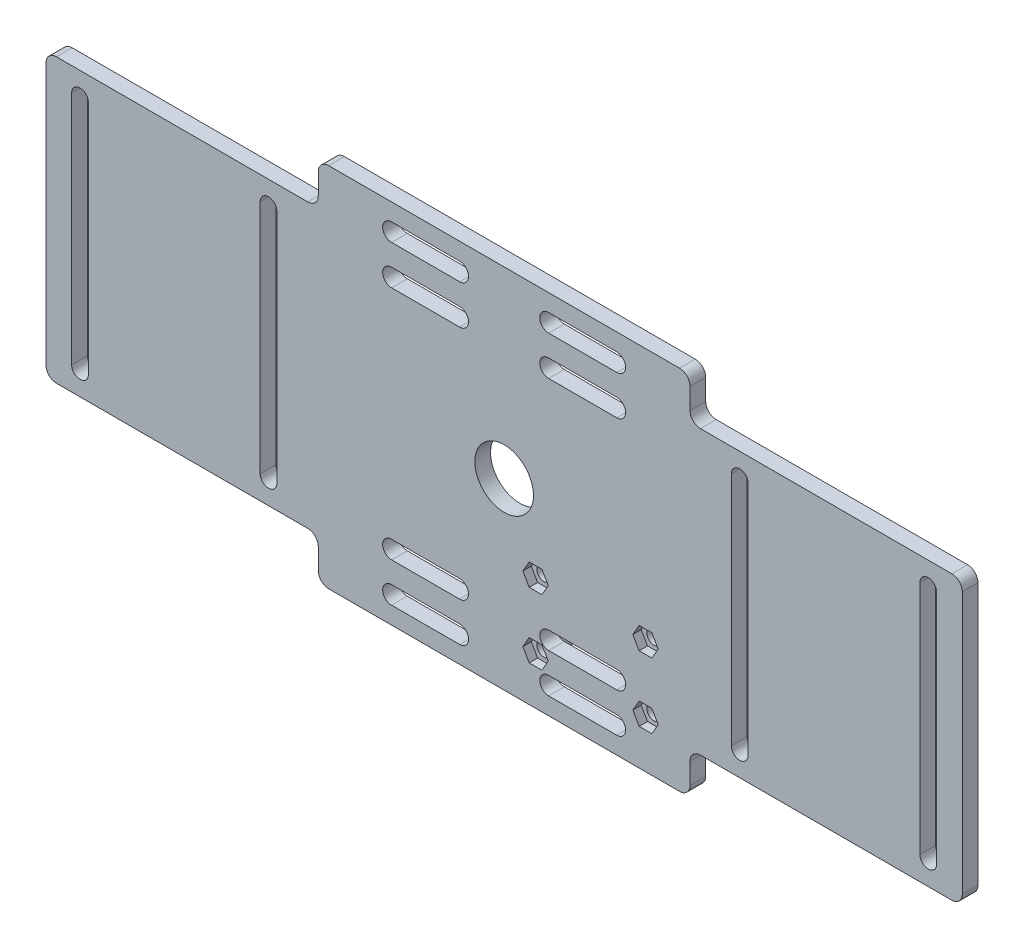
from build123d import *
from OCP.BRepFilletAPI import BRepFilletAPI_MakeChamfer
from build123d.topology import SkipClean

# Parameters (mm, degrees)
EXTRUDE_1_DEPTH     = 3
SKETCH_2_R          = 5.6
SKETCH_2_R_2        = 1.35
CUT_EXTRUDE_1_DEPTH = 95.288122264
CUT_EXTRUDE_2_DEPTH = 1.6
SKETCH_4_R          = 2.1
SKETCH_4_R_2        = 1.35
SKETCH_4_R_3        = 2
SKETCH_4_R_4        = 1.25
EXTRUDE_2_DEPTH     = 2
CHAMFER_1_SIZE      = 0.5
CHAMFER_1_SIZE2     = 0.288675135
FILLET_2_R          = 0.5


with BuildPart() as part:
    # 草圖1 → 填料-伸長1 (new body)
    with BuildSketch(Plane.XY):
        with BuildLine():
            Line((35.5, 33), (35.5, 29))
            ThreePointArc((35.5, 29), (36.085786438, 27.585786438), (37.5, 27))
            Line((37.5, 27), (85.5, 27))
            ThreePointArc((85.5, 27), (86.914213562, 26.414213562), (87.5, 25))
            Line((87.5, 25), (87.5, -25))
            ThreePointArc((87.5, -25), (86.914213562, -26.414213562), (85.5, -27))
            Line((85.5, -27), (37.5, -27))
            ThreePointArc((37.5, -27), (36.085786438, -27.585786438), (35.5, -29))
            Line((35.5, -29), (35.5, -33))
            ThreePointArc((35.5, -33), (34.914213562, -34.414213562), (33.5, -35))
            Line((33.5, -35), (-33.5, -35))
            ThreePointArc((-33.5, -35), (-34.914213562, -34.414213562), (-35.5, -33))
            Line((-35.5, -33), (-35.5, -29))
            ThreePointArc((-35.5, -29), (-36.085786438, -27.585786438), (-37.5, -27))
            Line((-37.5, -27), (-85.5, -27))
            ThreePointArc((-85.5, -27), (-86.914213562, -26.414213562), (-87.5, -25))
            Line((-87.5, -25), (-87.5, 25))
            ThreePointArc((-87.5, 25), (-86.914213562, 26.414213562), (-85.5, 27))
            Line((-85.5, 27), (-37.5, 27))
            ThreePointArc((-37.5, 27), (-36.085786438, 27.585786438), (-35.5, 29))
            Line((-35.5, 29), (-35.5, 33))
            ThreePointArc((-35.5, 33), (-34.914213562, 34.414213562), (-33.5, 35))
            Line((-33.5, 35), (33.5, 35))
            ThreePointArc((33.5, 35), (34.914213562, 34.414213562), (35.5, 33))
        make_face()
    extrude(amount=EXTRUDE_1_DEPTH)

    # 草圖2 → 除料-伸長1 (cut, through all)
    with BuildSketch(Plane.XY.offset(3)):
        Circle(SKETCH_2_R)
        with Locations((27, -13.5)):
            Circle(SKETCH_2_R_2)
        with Locations((6, -13.5)):
            Circle(SKETCH_2_R_2)
        with Locations((6, -26)):
            Circle(SKETCH_2_R_2)
        with Locations((27, -26)):
            Circle(SKETCH_2_R_2)
        with BuildLine():
            Line((43.4, -22.5), (43.4, 22.5))
            ThreePointArc((43.4, 22.5), (45, 24.1), (46.6, 22.5))
            Line((46.6, 22.5), (46.6, -22.5))
            ThreePointArc((46.6, -22.5), (45, -24.1), (43.4, -22.5))
        make_face()
        with BuildLine():
            Line((-46.6, -22.5), (-46.6, 22.5))
            ThreePointArc((-46.6, 22.5), (-45, 24.1), (-43.4, 22.5))
            Line((-43.4, 22.5), (-43.4, -22.5))
            ThreePointArc((-43.4, -22.5), (-45, -24.1), (-46.6, -22.5))
        make_face()
        with BuildLine():
            Line((-82.6, -22.5), (-82.6, 22.5))
            ThreePointArc((-82.6, 22.5), (-81, 24.1), (-79.4, 22.5))
            Line((-79.4, 22.5), (-79.4, -22.5))
            ThreePointArc((-79.4, -22.5), (-81, -24.1), (-82.6, -22.5))
        make_face()
        with BuildLine():
            Line((79.4, -22.5), (79.4, 22.5))
            ThreePointArc((79.4, 22.5), (81, 24.1), (82.6, 22.5))
            Line((82.6, 22.5), (82.6, -22.5))
            ThreePointArc((82.6, -22.5), (81, -24.1), (79.4, -22.5))
        make_face()
        with BuildLine():
            Line((21.5, -31.7), (8.5, -31.7))
            ThreePointArc((8.5, -31.7), (6.8, -30), (8.5, -28.3))
            Line((8.5, -28.3), (21.5, -28.3))
            ThreePointArc((21.5, -28.3), (23.2, -30), (21.5, -31.7))
        make_face()
        with BuildLine():
            Line((-21.5, -31.7), (-8.5, -31.7))
            ThreePointArc((-8.5, -31.7), (-6.8, -30), (-8.5, -28.3))
            Line((-8.5, -28.3), (-21.5, -28.3))
            ThreePointArc((-21.5, -28.3), (-23.2, -30), (-21.5, -31.7))
        make_face()
        with BuildLine():
            Line((21.5, 31.7), (8.5, 31.7))
            ThreePointArc((8.5, 31.7), (6.8, 30), (8.5, 28.3))
            Line((8.5, 28.3), (21.5, 28.3))
            ThreePointArc((21.5, 28.3), (23.2, 30), (21.5, 31.7))
        make_face()
        with BuildLine():
            Line((-21.5, 31.7), (-8.5, 31.7))
            ThreePointArc((-8.5, 31.7), (-6.8, 30), (-8.5, 28.3))
            Line((-8.5, 28.3), (-21.5, 28.3))
            ThreePointArc((-21.5, 28.3), (-23.2, 30), (-21.5, 31.7))
        make_face()
        with BuildLine():
            Line((21.5, 24.2), (8.5, 24.2))
            ThreePointArc((8.5, 24.2), (6.8, 22.5), (8.5, 20.8))
            Line((8.5, 20.8), (21.5, 20.8))
            ThreePointArc((21.5, 20.8), (23.2, 22.5), (21.5, 24.2))
        make_face()
        with BuildLine():
            Line((-21.5, 24.2), (-8.5, 24.2))
            ThreePointArc((-8.5, 24.2), (-6.8, 22.5), (-8.5, 20.8))
            Line((-8.5, 20.8), (-21.5, 20.8))
            ThreePointArc((-21.5, 20.8), (-23.2, 22.5), (-21.5, 24.2))
        make_face()
        with BuildLine():
            Line((-21.5, -24.2), (-8.5, -24.2))
            ThreePointArc((-8.5, -24.2), (-6.8, -22.5), (-8.5, -20.8))
            Line((-8.5, -20.8), (-21.5, -20.8))
            ThreePointArc((-21.5, -20.8), (-23.2, -22.5), (-21.5, -24.2))
        make_face()
        with BuildLine():
            Line((21.5, -24.2), (8.5, -24.2))
            ThreePointArc((8.5, -24.2), (6.8, -22.5), (8.5, -20.8))
            Line((8.5, -20.8), (21.5, -20.8))
            ThreePointArc((21.5, -20.8), (23.2, -22.5), (21.5, -24.2))
        make_face()
    extrude(amount=-CUT_EXTRUDE_1_DEPTH, mode=Mode.SUBTRACT)

    # 草圖3 → 除料-伸長2 (cut)
    with BuildSketch(Plane.XY.offset(3)):
        Polygon((29.424871131, -26), (28.212435565, -23.9), (25.787564435, -23.9), (24.575128869, -26), (25.787564435, -28.1), (28.212435565, -28.1), align=None)
        Polygon((8.424871131, -26), (7.212435565, -23.9), (4.787564435, -23.9), (3.575128869, -26), (4.787564435, -28.1), (7.212435565, -28.1), align=None)
        Polygon((29.424871131, -13.5), (28.212435565, -11.4), (25.787564435, -11.4), (24.575128869, -13.5), (25.787564435, -15.6), (28.212435565, -15.6), align=None)
        Polygon((8.424871131, -13.5), (7.212435565, -11.4), (4.787564435, -11.4), (3.575128869, -13.5), (4.787564435, -15.6), (7.212435565, -15.6), align=None)
    extrude(amount=-CUT_EXTRUDE_2_DEPTH, mode=Mode.SUBTRACT)

    # 草圖4 → 填料-伸長2 (add)
    # profile 1 of 4: a face of its own
    with SkipClean():  # the faces are left unmerged after this step: merging them gives an invalid solid
        with BuildSketch(Plane(origin=(0, 0, 0), x_dir=(-1, 0, 0), z_dir=(0, 0, -1))):
            with Locations((-27, -13.5)):
                Circle(SKETCH_4_R)
            with Locations((-27, -13.5)):
                Circle(SKETCH_4_R_2, mode=Mode.SUBTRACT)
        # profile 2 of 4: a face of its own
        with BuildSketch(Plane(origin=(0, 0, 0), x_dir=(-1, 0, 0), z_dir=(0, 0, -1))):
            with Locations((-27, -26)):
                Circle(SKETCH_4_R_3)
            with Locations((-27, -26)):
                Circle(SKETCH_4_R_4, mode=Mode.SUBTRACT)
        # profile 3 of 4: a face of its own
        with BuildSketch(Plane(origin=(0, 0, 0), x_dir=(-1, 0, 0), z_dir=(0, 0, -1))):
            with Locations((-6, -13.5)):
                Circle(SKETCH_4_R_3)
            with Locations((-6, -13.5)):
                Circle(SKETCH_4_R_4, mode=Mode.SUBTRACT)
        # profile 4 of 4: a face of its own
        with BuildSketch(Plane(origin=(0, 0, 0), x_dir=(-1, 0, 0), z_dir=(0, 0, -1))):
            with Locations((-6, -26)):
                Circle(SKETCH_4_R_3)
            with Locations((-6, -26)):
                Circle(SKETCH_4_R_4, mode=Mode.SUBTRACT)
        extrude(amount=EXTRUDE_2_DEPTH)

    # 導角1: one chamfer whose edges measure the first distance from different faces: ONE call of the kernel's chamfer builder (chamfer() names one face for all edges)
    chamfer_1_edges_1 = [part.edges().sort_by_distance(p)[0] for p in [
        (28.35, -13.5, -2),
    ]]
    chamfer_1_side_1 = [part.faces().sort_by_distance(p)[0] for p in [
        (29.04060303, -13.5, -2),
    ]]
    chamfer_1_edges_2 = [part.edges().sort_by_distance(p)[0] for p in [
        (7.25, -13.5, -2),
    ]]
    chamfer_1_side_2 = [part.faces().sort_by_distance(p)[0] for p in [
        (7.943431458, -13.5, -2),
    ]]
    chamfer_1_edges_3 = [part.edges().sort_by_distance(p)[0] for p in [
        (7.25, -26, -2),
    ]]
    chamfer_1_side_3 = [part.faces().sort_by_distance(p)[0] for p in [
        (7.943431458, -26, -2),
    ]]
    chamfer_1_edges_4 = [part.edges().sort_by_distance(p)[0] for p in [
        (28.25, -26, -2),
    ]]
    chamfer_1_side_4 = [part.faces().sort_by_distance(p)[0] for p in [
        (28.943431458, -26, -2),
    ]]
    chamfer_1 = BRepFilletAPI_MakeChamfer(part.part.solid().wrapped)
    for e in chamfer_1_edges_1:
        chamfer_1.Add(CHAMFER_1_SIZE, CHAMFER_1_SIZE2, e.wrapped, chamfer_1_side_1[0].wrapped)  # the first distance lies on this face
    for e in chamfer_1_edges_2:
        chamfer_1.Add(CHAMFER_1_SIZE, CHAMFER_1_SIZE2, e.wrapped, chamfer_1_side_2[0].wrapped)  # the first distance lies on this face
    for e in chamfer_1_edges_3:
        chamfer_1.Add(CHAMFER_1_SIZE, CHAMFER_1_SIZE2, e.wrapped, chamfer_1_side_3[0].wrapped)  # the first distance lies on this face
    for e in chamfer_1_edges_4:
        chamfer_1.Add(CHAMFER_1_SIZE, CHAMFER_1_SIZE2, e.wrapped, chamfer_1_side_4[0].wrapped)  # the first distance lies on this face
    add(Compound.cast(chamfer_1.Shape()), mode=Mode.REPLACE)

    # 圓角2
    fillet_2_edges = [part.edges().sort_by_distance(p)[0] for p in [
        (29.1, -13.5, 0),
        (8, -13.5, 0),
        (8, -26, 0),
        (29, -26, 0),
    ]]
    fillet(fillet_2_edges, radius=FILLET_2_R)


solid = part.part
